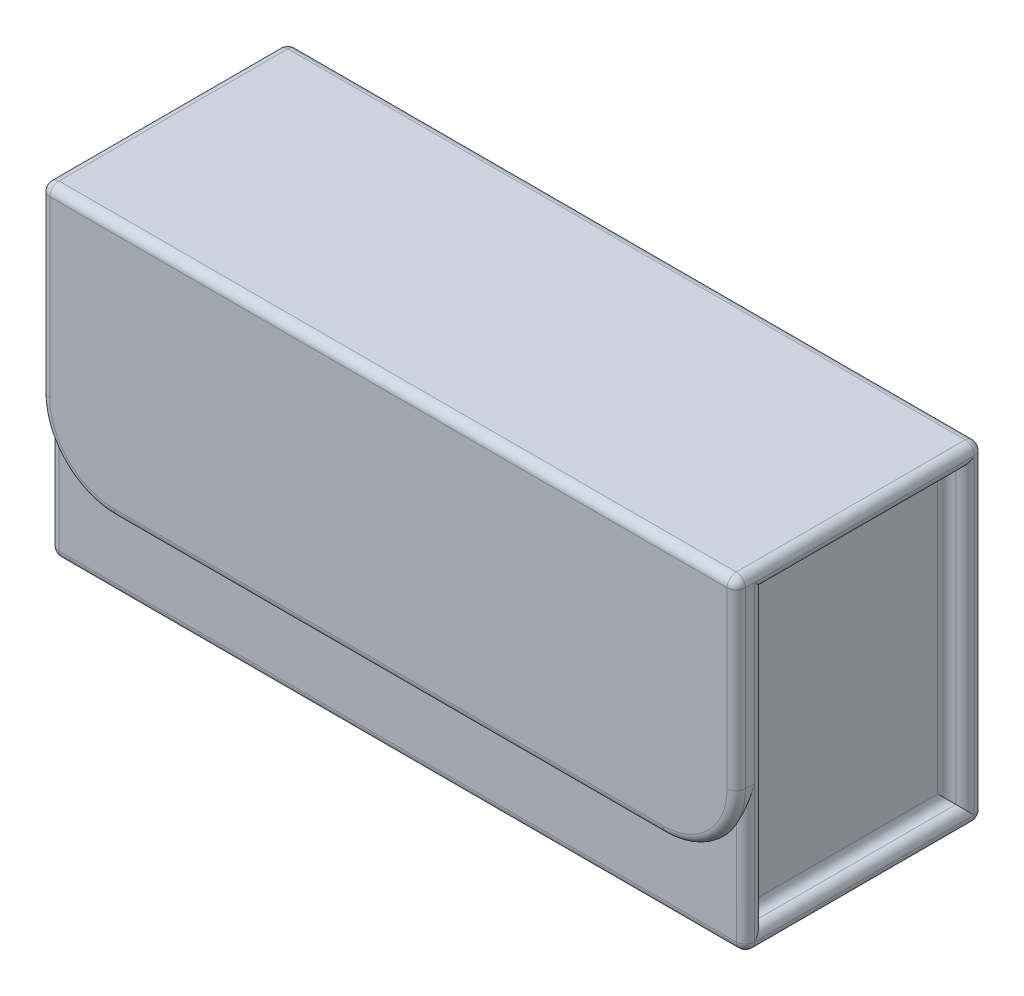
from build123d import *

# Parameters (mm, degrees)
SKETCH_1_W          = 190
SKETCH_1_H          = 65
EXTRUDE_1_DEPTH     = 45
SKETCH_3_W          = 55
SKETCH_3_H          = 80
CUT_EXTRUDE_1_DEPTH = 5
EXTRUDE_2_DEPTH     = 2.5
FILLET_2_R          = 2.5
FILLET_3_R          = 2.5
FILLET_4_R          = 2.5


# Some blends are built 0.0001 mm under size
with BuildPart() as part:
    # ｽｹｯﾁ1 → ﾎﾞｽ - 押し出し1 (new, symmetric)
    with BuildSketch(Plane(origin=(0, 0, 0), x_dir=(1, 0, 0), z_dir=(0, 1, 0))):
        Rectangle(SKETCH_1_W, SKETCH_1_H)
    extrude(amount=EXTRUDE_1_DEPTH, both=True)

    # ｽｹｯﾁ3 → ｶｯﾄ - 押し出し1 (cut)
    with BuildSketch(Plane(origin=(95, 0, 0), x_dir=(0, 0, -1), z_dir=(1, 0, 0))):
        Rectangle(SKETCH_3_W, SKETCH_3_H)
    cut_extrude_1 = extrude(amount=-CUT_EXTRUDE_1_DEPTH, mode=Mode.SUBTRACT)

    # ﾐﾗｰ1: ｶｯﾄ - 押し出し1 across plane
    add(cut_extrude_1.mirror(Plane(origin=(0, 0, 0), x_dir=(0, 0, 1), z_dir=(1, 0, 0))), mode=Mode.SUBTRACT)

    # ｽｹｯﾁ4 → ﾎﾞｽ - 押し出し2 (add)
    with BuildSketch(Plane.XY.offset(32.5)):
        with BuildLine():
            Line((-95, 45), (95, 45))
            Line((95, 45), (95, -5))
            ThreePointArc((95, -5), (89.142135624, -19.142135624), (75, -25))
            Line((75, -25), (-75, -25))
            ThreePointArc((-75, -25), (-89.142135624, -19.142135624), (-95, -5))
            Line((-95, -5), (-95, 45))
        make_face()
    extrude(amount=EXTRUDE_2_DEPTH)

    # ﾌｨﾚｯﾄ2
    fillet_2_edges = [part.edges().sort_by_distance(p)[0] for p in [
        (0, -45, -32.5),
        (-95, -45, 0),
        (0, -45, 32.5),
        (95, -45, 0),
        (-90, -40, 0),
        (-90, 0, -27.5),
        (-90, 40, 0),
        (-90, 0, 27.5),
        (90, 40, 0),
        (90, 0, -27.5),
        (90, -40, 0),
        (90, 0, 27.5),
        (95, -25, 32.5),
        (95, 0, -32.5),
        (95, 45, 1.25),
        (95, 0, 27.5),
        (95, -40, 0),
        (95, 0, -27.5),
        (95, 40, 0),
        (-95, -25, 32.5),
        (-95, 0, -32.5),
        (-95, 45, 1.25),
        (-95, 0, -27.5),
        (-95, -40, 0),
        (-95, 0, 27.5),
        (-95, 40, 0),
    ]]
    fillet(fillet_2_edges, radius=FILLET_2_R - 0.0001)  # a hair under: the kernel refuses the full size

    # ﾌｨﾚｯﾄ3
    fillet_3_edges = [part.edges().sort_by_distance(p)[0] for p in [
        (94.267796242, 44.267796242, 35),
        (95, 18.75005, 35),
        (89.142135624, -19.142135624, 35),
        (0, -25, 35),
        (-89.142135624, -19.142135624, 35),
        (-95, 18.75005, 35),
        (-94.267796242, 44.267796242, 35),
        (0, 45, 35),
    ]]
    fillet(fillet_3_edges, radius=FILLET_3_R - 0.0001)  # a hair under: the kernel refuses the full size

    # ﾌｨﾚｯﾄ4
    # the kernel refuses this fillet: 2.5 mm, written as the material it takes off along each edge
    with BuildSketch(Plane(origin=(95, 42.5, -30), x_dir=(0, 0, -1), z_dir=(0, -1, 0))) as fillet_4_piece_1:
        with BuildLine():
            CenterArc((0.0001, -2.4999), 2.4999, 0, 90)
            Line((2.5, -2.4999), (2.5, 0))
            Line((2.5, 0), (0.0001, 0))
        make_face()
    revolve(axis=Axis((95, 42.5, -30), (1, 0, 0)), revolution_arc=90, mode=Mode.SUBTRACT)
    with BuildSketch(Plane(origin=(-95, 42.5, -30), x_dir=(0, 1, 0), z_dir=(0, 0, 1))) as fillet_4_piece_2:
        with BuildLine():
            CenterArc((0.0001, -2.4999), 2.4999, 0, 90)
            Line((2.5, -2.4999), (2.5, 0))
            Line((2.5, 0), (0.0001, 0))
        make_face()
    revolve(axis=Axis((-95, 42.5, -30), (-1, 0, 0)), revolution_arc=90, mode=Mode.SUBTRACT)
    with BuildSketch(Plane(origin=(95, 45, -32.5), x_dir=(0, 0, 1), z_dir=(-1, 0, 0))) as fillet_4_piece_3:
        with BuildLine():
            CenterArc((FILLET_4_R, -FILLET_4_R), FILLET_4_R, 90, 90)
            Line((0, -FILLET_4_R), (0, 0))
            Line((0, 0), (FILLET_4_R, 0))
        make_face()
    extrude(amount=190, mode=Mode.SUBTRACT)


solid = part.part
